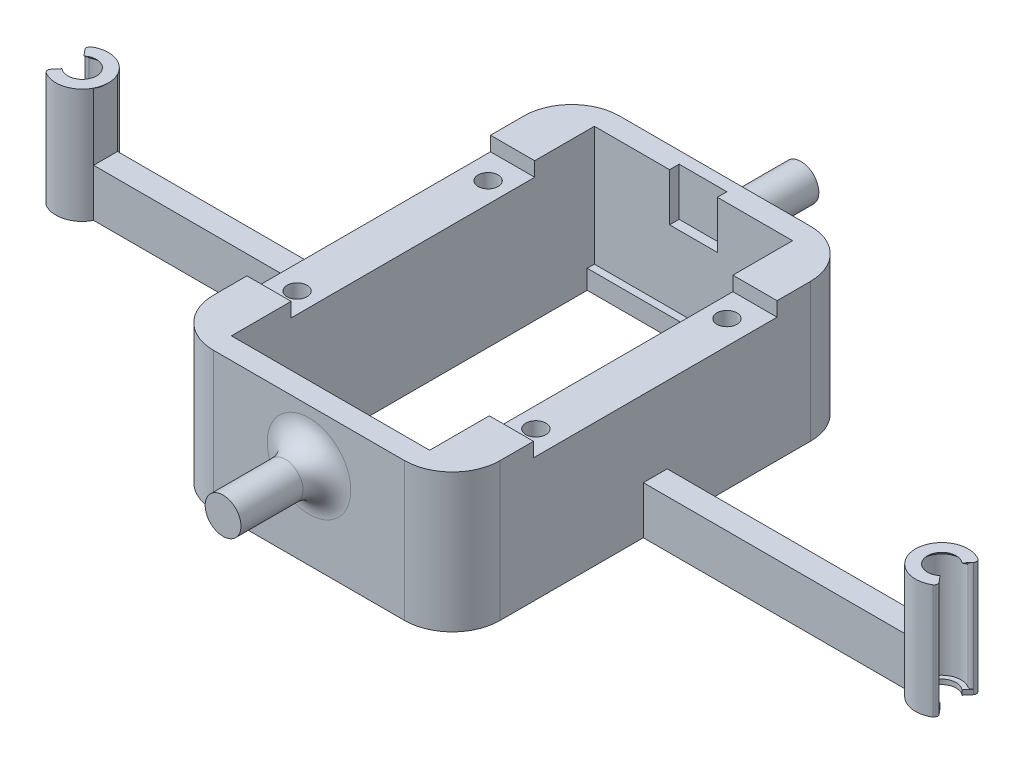
from build123d import *

# Parameters (mm, degrees)
BOSS_EXTRUDE1_DEPTH  = 24
SKETCH22_W           = 60.00000000000001
SKETCH22_H           = 85
BOSS_EXTRUDE6_DEPTH  = 5
SKETCH5_W            = 41.5
SKETCH5_H            = 76
CUT_EXTRUDE1_DEPTH   = 25
SKETCH17_W           = 60
SKETCH17_H           = 51
CUT_EXTRUDE10_DEPTH  = 3
SKETCH8_W            = 55.101020514433614
SKETCH8_H            = 14
CUT_EXTRUDE3_DEPTH   = 108.77225201740228
FILLET4_R            = 10
BOSS_EXTRUDE3_DEPTH  = 1
BOSS_EXTRUDE3_DRAFT  = -45.0000000000001
MIRROR6_COPY_1_DEPTH = 1
MIRROR6_COPY_1_DRAFT = -45.0000000000001
BOSS_EXTRUDE4_DEPTH  = 1
FILLET3_R            = 0.75
SKETCH15_R           = 2.100000000000001
CUT_EXTRUDE8_DEPTH   = 106.67266341818518
SKETCH20_W           = 41.499999999999986
SKETCH20_H           = 72.99999999999999
CUT_EXTRUDE11_DEPTH  = 5
SKETCH21_R           = 3.75
BOSS_EXTRUDE5_DEPTH  = 18
FILLET5_R            = 5
SKETCH24_W           = 10
SKETCH24_H           = 2
CUT_EXTRUDE12_DEPTH  = 10


with BuildPart() as part:
    # Sketch4 → Boss-Extrude1 (new body)
    with BuildSketch(Plane(origin=(0, 0, 0), x_dir=(1, 0, 0), z_dir=(0, 1, 0))):
        with BuildLine():
            Line((-30, 2.499999999999996), (-30, 42.5))
            Line((-30, 42.5), (30, 42.5))
            Line((30, 42.5), (30, 2.499999999999996))
            Line((30, 2.499999999999996), (85.10102051443361, 2.49999999999999))
            ThreePointArc((85.10102051443361, 2.49999999999999), (88.90515510613471, 5.389927147780134), (93.53533185327602, 4.213244437154374))
            Line((93.53533185327602, 4.213244437154374), (92.57115043874622, 3.064177772475905))
            ThreePointArc((92.57115043874622, 3.064177772475905), (86, -2.572e-14), (92.57115043874622, -3.0641777724758823))
            Line((92.57115043874622, -3.0641777724758823), (93.53533185327602, -4.213244437154351))
            ThreePointArc((93.53533185327602, -4.213244437154351), (88.90515510613471, -5.389927147780135), (85.10102051443361, -2.499999999999969))
            Line((85.10102051443361, -2.499999999999969), (30, -2.4999999999999893))
            Line((30, -2.4999999999999893), (30.00000000000001, -42.499999999999986))
            Line((30.00000000000001, -42.499999999999986), (-30.00000000000001, -42.499999999999986))
            Line((-30.00000000000001, -42.499999999999986), (-30, -2.4999999999999893))
            Line((-30, -2.4999999999999893), (-85.10102051443361, -2.499999999999969))
            ThreePointArc((-85.10102051443361, -2.499999999999969), (-88.90515510613471, -5.389927147780135), (-93.53533185327602, -4.213244437154351))
            Line((-93.53533185327602, -4.213244437154351), (-92.57115043874622, -3.0641777724758823))
            ThreePointArc((-92.57115043874622, -3.0641777724758823), (-86, -2.523e-14), (-92.57115043874622, 3.064177772475905))
            Line((-92.57115043874622, 3.064177772475905), (-93.53533185327602, 4.213244437154374))
            ThreePointArc((-93.53533185327602, 4.213244437154374), (-88.90515510613471, 5.389927147780134), (-85.10102051443361, 2.49999999999999))
            Line((-85.10102051443361, 2.49999999999999), (-30, 2.499999999999996))
        make_face()
    extrude(amount=BOSS_EXTRUDE1_DEPTH)

    # Sketch22 → Boss-Extrude6 (add)
    with BuildSketch(Plane(origin=(0, 24, 0), x_dir=(1, 0, 0), z_dir=(0, 1, 0))):
        Rectangle(SKETCH22_W, SKETCH22_H)
    extrude(amount=BOSS_EXTRUDE6_DEPTH)

    # Sketch5 → Cut-Extrude1 (cut)
    with BuildSketch(Plane(origin=(0, 29, 0), x_dir=(1, 0, 0), z_dir=(0, 1, 0))):
        Rectangle(SKETCH5_W, SKETCH5_H)
    extrude(amount=-CUT_EXTRUDE1_DEPTH, mode=Mode.SUBTRACT)

    # Sketch17 → Cut-Extrude10 (cut)
    with BuildSketch(Plane(origin=(0, 29, 0), x_dir=(1, 0, 0), z_dir=(0, 1, 0))):
        Rectangle(SKETCH17_W, SKETCH17_H)
    extrude(amount=-CUT_EXTRUDE10_DEPTH, mode=Mode.SUBTRACT)

    # Sketch8 → Cut-Extrude3 (cut, through all)
    with BuildSketch(Plane.XY.offset(2.5000000000000004)):
        with Locations((-57.55051025721681, 17)):
            Rectangle(SKETCH8_W, SKETCH8_H)
        with Locations((57.55051025721681, 17)):
            Rectangle(SKETCH8_W, SKETCH8_H)
    extrude(amount=-CUT_EXTRUDE3_DEPTH, mode=Mode.SUBTRACT)

    # Fillet4
    fillet4_edges = [part.edges().sort_by_distance(p)[0] for p in [
        (-30, 14.5, -42.5),
        (30, 14.5, -42.5),
        (30.000000000000007, 14.5, 42.49999999999999),
        (-30.000000000000007, 14.5, 42.49999999999999),
    ]]
    fillet(fillet4_edges, radius=FILLET4_R)


with BuildPart() as boss_extrude3_tool:
    # Sketch11 → Boss-Extrude3 (with draft: the straight prism first)
    with BuildSketch(Plane(origin=(0, 24, 0), x_dir=(1, 0, 0), z_dir=(0, 1, 0))):
        with BuildLine():
            Line((-93.535331853276, 4.21324443715433), (-91.92836282905964, 2.2981333293569084))
            ThreePointArc((-91.92836282905964, 2.2981333293569084), (-87.00000000000001, -1.768e-14), (-91.92836282905964, -2.2981333293569084))
            Line((-91.92836282905964, -2.2981333293569084), (-93.535331853276, -4.21324443715433))
            ThreePointArc((-93.535331853276, -4.21324443715433), (-84.50000000000001, -1.835e-14), (-93.535331853276, 4.21324443715433))
        make_face()
    extrude(amount=-BOSS_EXTRUDE3_DEPTH)
    # Boss-Extrude3: the draft: its side faces are tilted about the plane it starts from
    boss_extrude3_sides = [boss_extrude3_tool.faces().sort_by_distance(p)[0] for p in [
        (-92.731847341, 23.5, -3.255688883),
        (-87, 23.5, 0),
        (-92.731847341, 23.5, 3.255688883),
        (-84.5, 23.5, 0),
    ]]
    draft(boss_extrude3_sides, Plane(origin=(0, 24, 0), x_dir=(1, 0, 0), z_dir=(0, 1, 0)), BOSS_EXTRUDE3_DRAFT)


with BuildPart() as part_1:
    add(part.part)

    # Boss-Extrude3: add boss_extrude3_tool
    add(boss_extrude3_tool.part)


with BuildPart() as mirror6_copy_1_tool:
    # Mirror6 copy 1 sketch → Mirror6 copy 1 (with draft: the straight prism first)
    with BuildSketch(Plane(origin=(0, 24, 0), x_dir=(-1, 0, 0), z_dir=(0, 1, 0))):
        with BuildLine():
            Line((-93.535331853276, -4.21324443715433), (-91.92836282905964, -2.2981333293569084))
            ThreePointArc((-91.92836282905964, -2.2981333293569084), (-87.00000000000001, 1.768e-14), (-91.92836282905964, 2.2981333293569084))
            Line((-91.92836282905964, 2.2981333293569084), (-93.535331853276, 4.21324443715433))
            ThreePointArc((-93.535331853276, 4.21324443715433), (-84.50000000000001, 1.835e-14), (-93.535331853276, -4.21324443715433))
        make_face()
    extrude(amount=-MIRROR6_COPY_1_DEPTH)
    # Mirror6 copy 1: the draft: its side faces are tilted about the plane it starts from
    mirror6_copy_1_sides = [mirror6_copy_1_tool.faces().sort_by_distance(p)[0] for p in [
        (92.731847341, 23.5, -3.255688883),
        (87, 23.5, 0),
        (92.731847341, 23.5, 3.255688883),
        (84.5, 23.5, 0),
    ]]
    draft(mirror6_copy_1_sides, Plane(origin=(0, 24, 0), x_dir=(-1, 0, 0), z_dir=(0, 1, 0)), MIRROR6_COPY_1_DRAFT)


with BuildPart() as part_2:
    add(part_1.part)

    # Mirror6 copy 1: add mirror6_copy_1_tool
    add(mirror6_copy_1_tool.part)

    # Sketch12 → Boss-Extrude4 (add)
    with BuildSketch(Plane.XZ):
        with BuildLine():
            Line((-93.53533185327602, 4.213244437154351), (-91.92836282905965, 2.2981333293569315))
            ThreePointArc((-91.92836282905965, 2.2981333293569315), (-87, 1.768e-14), (-91.92836282905964, -2.298133329356913))
            Line((-91.92836282905964, -2.298133329356913), (-93.53533185327602, -4.213244437154374))
            ThreePointArc((-93.53533185327602, -4.213244437154374), (-84.49999999999996, 2.568e-14), (-93.53533185327602, 4.213244437154351))
        make_face()
    boss_extrude4 = extrude(amount=-BOSS_EXTRUDE4_DEPTH)

    # Mirror5: Boss-Extrude4 across plane
    add(boss_extrude4.mirror(Plane(origin=(0, 0, 0), x_dir=(0, 0, 1), z_dir=(1, 0, 0))))

    # Fillet3
    fillet3_edges = [part_2.edges().sort_by_distance(p)[0] for p in [
        (93.535331853276, 12, 4.213244437154348),
        (92.57115043874622, 12.5, 3.064177772475879),
        (92.57115043874622, 12.5, -3.064177772475902),
        (93.535331853276, 12, -4.213244437154364),
        (-93.535331853276, 12, 4.213244437154348),
        (-92.57115043874622, 12.5, 3.064177772475879),
        (-93.535331853276, 12, -4.213244437154364),
        (-92.57115043874622, 12.5, -3.064177772475902),
    ]]
    fillet(fillet3_edges, radius=FILLET3_R - 0.0001)  # a hair under: the kernel refuses the full size

    # Sketch15 → Cut-Extrude8 (cut, through all)
    with BuildSketch(Plane(origin=(0, 26.000000000000004, 0), x_dir=(1, 0, 0), z_dir=(0, 1, 0))):
        with Locations(Location((-25, 20.000000000000004, 0), (0, 0, 270))):
            Circle(SKETCH15_R)
        with Locations(Location((25, 20.000000000000004, 0), (0, 0, 90))):
            Circle(SKETCH15_R)
        with Locations(Location((25, -20.000000000000004, 0), (0, 0, 270))):
            Circle(SKETCH15_R)
        with Locations(Location((-25, -20.000000000000004, 0), (0, 0, 90))):
            Circle(SKETCH15_R)
    extrude(amount=-CUT_EXTRUDE8_DEPTH, mode=Mode.SUBTRACT)

    # Sketch20 → Cut-Extrude11 (cut)
    with BuildSketch(Plane(origin=(0, 4, 0), x_dir=(1, 0, 0), z_dir=(0, 1, 0))):
        Rectangle(SKETCH20_W, SKETCH20_H)
    extrude(amount=-CUT_EXTRUDE11_DEPTH, mode=Mode.SUBTRACT)

    # Sketch21 → Boss-Extrude5 (add)
    with BuildSketch(Plane.XY.offset(42.499999999999986)):
        with Locations(Location((0, 18, 0), (0, 0, 180))):
            Circle(SKETCH21_R)
    boss_extrude5 = extrude(amount=BOSS_EXTRUDE5_DEPTH)

    # Mirror9: Boss-Extrude5 across plane
    add(boss_extrude5.mirror(Plane.XY))

    # Fillet5
    fillet5_edges = [part_2.edges().sort_by_distance(p)[0] for p in [
        (3.75, 17.999999999999996, 42.499999999999986),
        (3.75, 17.999999999999996, -42.499999999999986),
    ]]
    fillet(fillet5_edges, radius=FILLET5_R)

    # Sketch24 → Cut-Extrude12 (cut)
    with BuildSketch(Plane(origin=(0, 29, 0), x_dir=(1, 0, 0), z_dir=(0, 1, 0))):
        with Locations((0, 38.999999999999986)):
            Rectangle(SKETCH24_W, SKETCH24_H)
    extrude(amount=-CUT_EXTRUDE12_DEPTH, mode=Mode.SUBTRACT)


solid = part_2.part
